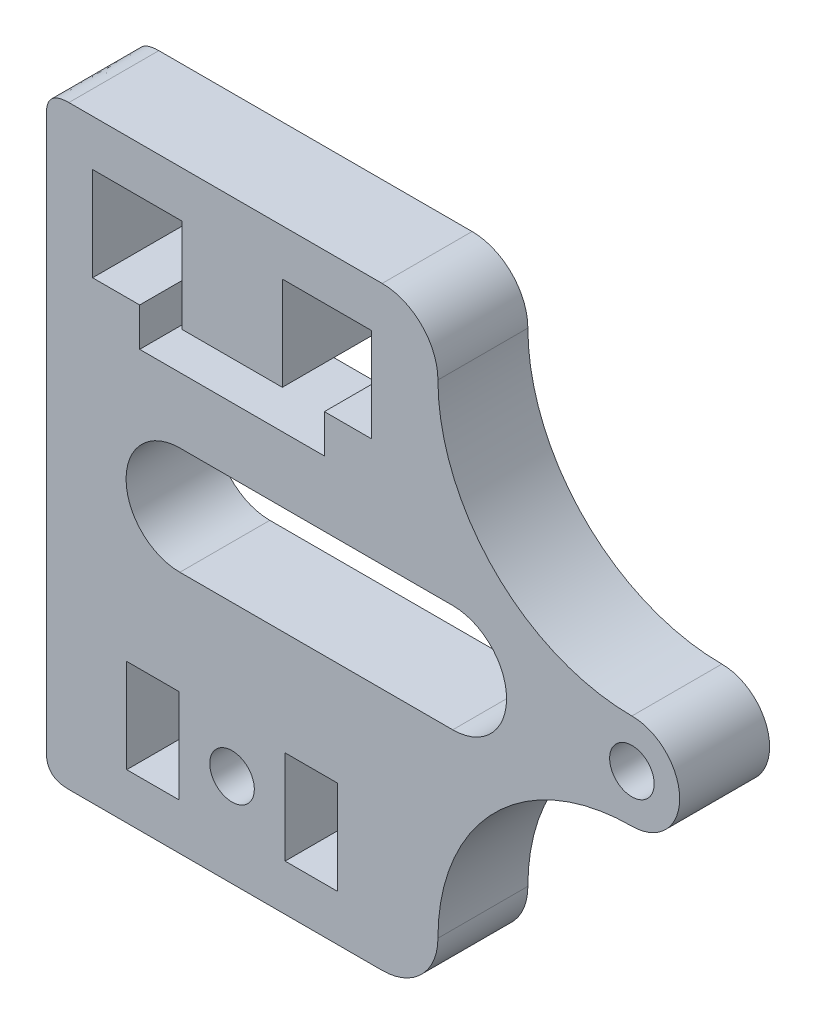
from build123d import *

# Parameters (mm, degrees)
SKETCH1_R           = 1.45
SKETCH1_W           = 3.400011
SKETCH1_H           = 6.1
BOSS_EXTRUDE2_DEPTH = 5.85
SKETCH2_R           = 1.25
CUT_EXTRUDE1_DEPTH  = 1


with BuildPart() as part:
    # Sketch1 → Boss-Extrude2 (new body)
    with BuildSketch(Plane.XY):
        with BuildLine():
            Line((388.946531589, 563.988903138), (409.324633118, 563.988903138))
            ThreePointArc((409.324633118, 563.988903138), (411.889147311, 562.926646578), (412.95140387, 560.362132386))
            ThreePointArc((412.95140387, 560.362132386), (416.647126977, 551.439867539), (425.569391823, 547.744144433))
            ThreePointArc((425.569391823, 547.744144433), (428.674633118, 544.638903138), (425.569391823, 541.533661842))
            ThreePointArc((425.569391823, 541.533661842), (416.647126977, 537.837938736), (412.95140387, 528.915673889))
            ThreePointArc((412.95140387, 528.915673889), (411.889147311, 526.351159697), (409.324633118, 525.288903138))
            Line((409.324633118, 525.288903138), (388.946531589, 525.288903138))
            add(Edge.make_bspline(
                [(387.48851407, 526.74542963), (387.408268294, 525.288903138), (388.946531589, 525.288903138)],
                knots=[0, 0, 0, 1, 1, 1], degree=2))
            Line((387.48851407, 526.74542963), (387.48851407, 562.532375923))
            add(Edge.make_bspline(
                [(387.48851407, 562.532375923), (387.408267487, 563.988903138), (388.946531589, 563.988903138)],
                knots=[0, 0, 0, 1, 1, 1], degree=2))
        make_face()
        with Locations((425.569391823, 544.638903138)):
            Circle(SKETCH1_R, mode=Mode.SUBTRACT)
        with Locations((399.559046996, 531.338903138)):
            Circle(SKETCH1_R, mode=Mode.SUBTRACT)
        Polygon((405.566920996, 552.388903138), (405.566920996, 554.888903138), (408.629579922, 554.888903138), (408.629579922, 560.988903138), (402.829579922, 560.988903138), (402.829579922, 554.888903138), (396.28851407, 554.888903138), (396.28851407, 560.988903138), (390.48851407, 560.988903138), (390.48851407, 554.888903138), (393.551172996, 554.888903138), (393.551172996, 552.388903138), align=None, mode=Mode.SUBTRACT)
        with Locations((394.409041496, 531.338903138)):
            Rectangle(SKETCH1_W, SKETCH1_H, mode=Mode.SUBTRACT)
        with Locations((404.709052496, 531.338903138)):
            Rectangle(SKETCH1_W, SKETCH1_H, mode=Mode.SUBTRACT)
        with BuildLine():
            Line((396.165690223, 548.138903138), (413.915690223, 548.138903138))
            ThreePointArc((413.915690223, 548.138903138), (417.415690223, 544.638903138), (413.915690223, 541.138903138))
            Line((413.915690223, 541.138903138), (396.165690223, 541.138903138))
            ThreePointArc((396.165690223, 541.138903138), (392.665690223, 544.638903138), (396.165690223, 548.138903138))
        make_face(mode=Mode.SUBTRACT)
    extrude(amount=BOSS_EXTRUDE2_DEPTH)

    # Sketch2 → Cut-Extrude1 (cut)
    with BuildSketch(Plane.XY):
        with Locations((409.659057996, 531.338903138)):
            Circle(SKETCH2_R)
    extrude(amount=CUT_EXTRUDE1_DEPTH, mode=Mode.SUBTRACT)


solid = part.part
